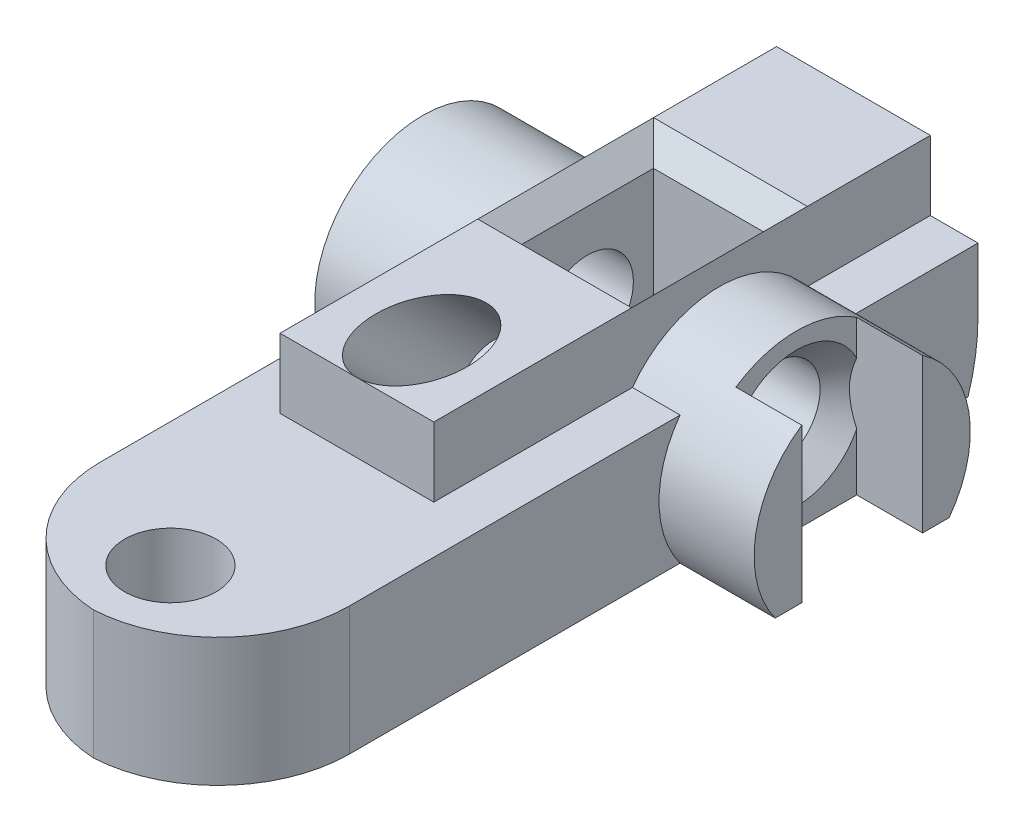
from build123d import *

# Parameters (mm, degrees)
BOSS_EXTRUDE1_DEPTH      = 20
SKETCH3_W                = 11.34
SKETCH3_H                = 5.84
BOSS_EXTRUDE2_DEPTH      = 25
FILLET1_R                = 6
SKETCH4_W                = 7
SKETCH4_H                = 8
BOSS_EXTRUDE3_DEPTH      = 9
BOSS_EXTRUDE4_DEPTH      = 13
BOSS_EXTRUDE4_DEPTH_BACK = 9.6
SKETCH10_W               = 7
SKETCH10_H               = 3.16
SKETCH5_W                = 5
SKETCH5_H                = 6
CUT_EXTRUDE1_DEPTH       = 9
SKETCH6_R                = 2.0825
CUT_EXTRUDE2_DEPTH       = 5.84
CUT_EXTRUDE3_REACH       = 34.581
SKETCH8_R                = 2.0825
CUT_EXTRUDE4_REACH       = 35.25
CUT_EXTRUDE4_END_RADIUS  = 4.92
CUT_EXTRUDE5_DEPTH       = 11.34
SKETCH13_R               = 2.0825
CUT_EXTRUDE7_DEPTH       = 8
SKETCH14_W               = 5
SKETCH14_H               = 6
BOSS_EXTRUDE5_DEPTH      = 1


with BuildPart() as part:
    # Sketch2 → Boss-Extrude1 (new body)
    with BuildSketch(Plane(origin=(0, 0, 0), x_dir=(0, 0, -1), z_dir=(1, 0, 0))):
        with BuildLine():
            Line((3.959797975, -2.92), (-3.959797975, -2.92))
            ThreePointArc((-3.959797975, -2.92), (-4.92, 0), (-3.959797975, 2.92))
            ThreePointArc((-3.959797975, 2.92), (0, 4.92), (3.959797975, 2.92))
            ThreePointArc((3.959797975, 2.92), (4.92, 0), (3.959797975, -2.92))
        make_face()
    extrude(amount=BOSS_EXTRUDE1_DEPTH)

    # Sketch3 → Boss-Extrude2 (add)
    with BuildSketch(Plane.XY):
        with Locations((10, 0)):
            Rectangle(SKETCH3_W, SKETCH3_H)
    extrude(amount=BOSS_EXTRUDE2_DEPTH)

    # Fillet1
    # the kernel refuses this fillet: 6 mm, written as the material it takes off along each edge
    with BuildSketch(Plane(origin=(15.67, -17.92, 25), x_dir=(0, 0, -1), z_dir=(0, 1, 0)), Plane(origin=(4.33, 17.92, 25), x_dir=(0, 0, -1), z_dir=(0, -1, 0))) as fillet1_piece_1:
        with BuildLine():
            CenterArc((FILLET1_R, FILLET1_R), FILLET1_R, 180, 90)
            Line((0, FILLET1_R), (0, 0))
            Line((0, 0), (FILLET1_R, 0))
        make_face()
    extrude(amount=35.84, mode=Mode.SUBTRACT)

    # Sketch4 → Boss-Extrude3 (add)
    with BuildSketch(Plane.XZ.offset(2.92)):
        with Locations((10, 0.040202025)):
            Rectangle(SKETCH4_W, SKETCH4_H)
    extrude(amount=-BOSS_EXTRUDE3_DEPTH)

    # Sketch10 → Boss-Extrude4 (add, two sides: drawn at the far end of the back side and taken through both)
    with BuildSketch(Plane.XY.offset(-BOSS_EXTRUDE4_DEPTH_BACK)):
        with Locations((10, 4.5)):
            Rectangle(SKETCH10_W, SKETCH10_H)
        Polygon((6.5, 2.92), (13.5, 2.92), (15.67, 2.92), (15.67, -2.92), (10, -2.92), (4.33, -2.92), (4.33, 2.92), align=None)
    extrude(amount=BOSS_EXTRUDE4_DEPTH + BOSS_EXTRUDE4_DEPTH_BACK)

    # Sketch5 → Cut-Extrude1 (cut)
    with BuildSketch(Plane(origin=(0, 6.08, 0), x_dir=(1, 0, 0), z_dir=(0, 1, 0))):
        with Locations((10, 0)):
            Rectangle(SKETCH5_W, SKETCH5_H)
    extrude(amount=-CUT_EXTRUDE1_DEPTH, mode=Mode.SUBTRACT)

    # Sketch6 → Cut-Extrude2 (cut)
    with BuildSketch(Plane(origin=(0, 2.92, 0), x_dir=(1, 0, 0), z_dir=(0, 1, 0))):
        with Locations(Location((10, -21.490918127, 0), (0, 0, 180))):
            Circle(SKETCH6_R)
    extrude(amount=-CUT_EXTRUDE2_DEPTH, mode=Mode.SUBTRACT)

    # Cut-Extrude3: up to this face of the body (flat: up to its plane)
    cut_extrude3_end = Plane(part.part.faces().sort_by_distance((0, 0.637144392, 0))[0])
    # Sketch8 → Cut-Extrude3 (cut, up to the picked face)
    with BuildSketch(Plane(origin=(20, 0, 0), x_dir=(0, 0, -1), z_dir=(1, 0, 0)), mode=Mode.PRIVATE) as cut_extrude3_sk1:
        with Locations((0, 1.08)):
            Circle(SKETCH8_R)
    cut_extrude3_tool1 = split(extrude(cut_extrude3_sk1.sketch, amount=-CUT_EXTRUDE3_REACH, mode=Mode.PRIVATE), bisect_by=cut_extrude3_end, keep=Keep.BOTH, mode=Mode.PRIVATE)
    add(cut_extrude3_tool1.solids().sort_by(Axis((20, 1.08, 0), (-1, 0, 0)))[0], mode=Mode.SUBTRACT)

    # Cut-Extrude4: up to this cylinder (the profile starts inside it)
    cut_extrude4_end = Plane(origin=(18.5, 0, 0), z_dir=(-1, 0, 0)) * Cylinder(CUT_EXTRUDE4_END_RADIUS, 81.34, mode=Mode.PRIVATE)
    # Sketch9 → Cut-Extrude4 (cut, up to the surface)
    with BuildSketch(Plane(origin=(0, -2.92, 0), x_dir=(1, 0, 0), z_dir=(0, 1, 0)), mode=Mode.PRIVATE) as cut_extrude4_sk1:
        Polygon((17, -2.75), (20, -2.75), (20, -2.0825), (20, 2.0825), (20, 2.75), (17, 2.75), align=None)
    cut_extrude4_tool1 = extrude(cut_extrude4_sk1.sketch, amount=CUT_EXTRUDE4_REACH, mode=Mode.PRIVATE) & cut_extrude4_end
    add(cut_extrude4_tool1.solids().sort_by_distance((18.5, -2.92, 0))[0], mode=Mode.SUBTRACT)

    # Chamfer1
    # the kernel refuses this chamfer: 1 mm, written as the material it takes off along each edge
    with BuildSketch(Plane(origin=(12.5, 6.08, 3), x_dir=(-0.027495876610585623, -0.9996219169112968, 0), z_dir=(0, 0, -1)), Plane(origin=(7.5, 6.08, -3), x_dir=(0.027495876610586487, -0.9996219169112968, 0), z_dir=(0, 0, 1))) as chamfer1_piece_1:
        with BuildLine():
            Line((1.028673195, 0), (-0.056547155, -1.027117794))
            Line((-0.056547155, -1.027117794), (-0.076539593, -1.026567876))
            ThreePointArc((-0.076539593, -1.026567876), (-0.034129227, -0.51339783), (-0.019992438, 0.000549918))
            Line((-0.019992438, 0.000549918), (0.000549918, 0.019992438))
            ThreePointArc((0.000549918, 0.019992438), (0.514497665, 0.00585565), (1.029223113, 0.019992438))
            Line((1.029223113, 0.019992438), (1.028673195, 0))
        make_face()
    extrude(amount=6, mode=Mode.SUBTRACT)
    with BuildSketch(Plane(origin=(12.5, 6.08, -3), x_dir=(0, -0.9996219169112968, 0.027495876610586487), z_dir=(-1, 0, 0)), Plane(origin=(7.5, 6.08, 3), x_dir=(0, -0.9996219169112968, -0.027495876610586487), z_dir=(1, 0, 0))) as chamfer1_piece_2:
        with BuildLine():
            Line((1.028673195, 0), (-0.056547155, -1.027117794))
            Line((-0.056547155, -1.027117794), (-0.076539593, -1.026567876))
            ThreePointArc((-0.076539593, -1.026567876), (-0.034129227, -0.51339783), (-0.019992438, 0.000549918))
            Line((-0.019992438, 0.000549918), (0.000549918, 0.019992438))
            ThreePointArc((0.000549918, 0.019992438), (0.514497665, 0.00585565), (1.029223113, 0.019992438))
            Line((1.029223113, 0.019992438), (1.028673195, 0))
        make_face()
    extrude(amount=5, mode=Mode.SUBTRACT)
    with BuildSketch(Plane(origin=(0, 1.08, 0), x_dir=(0, 0, -1), z_dir=(0, -1, 0))) as chamfer1_piece_3:
        with BuildLine():
            Line((3.110784271, -0.028284271), (2.054215729, 1.028284271))
            Line((2.054215729, 1.028284271), (2.034215729, 1.028284271))
            ThreePointArc((2.034215729, 1.028284271), (2.0625, 0.514142136), (2.0625, 0))
            Line((2.0625, 0), (2.0825, -0.02))
            ThreePointArc((2.0825, -0.02), (2.596642136, -0.02), (3.110784271, -0.048284271))
            Line((3.110784271, -0.048284271), (3.110784271, -0.028284271))
        make_face()
    revolve(axis=Axis((0, 1.08, 0), (1, 0, 0)), mode=Mode.SUBTRACT)
    with BuildSketch(Plane(origin=(17, 1.08, 0), x_dir=(0, 0, -1), z_dir=(0, -1, 0))) as chamfer1_piece_4_section:
        with BuildLine():
            Line((3.110784271, 0.028284271), (2.054215729, -1.028284271))
            Line((2.054215729, -1.028284271), (2.034215729, -1.028284271))
            ThreePointArc((2.034215729, -1.028284271), (2.0625, -0.514142136), (2.0625, 0))
            Line((2.0625, 0), (2.0825, 0.02))
            ThreePointArc((2.0825, 0.02), (2.596642136, 0.02), (3.110784271, 0.048284271))
            Line((3.110784271, 0.048284271), (3.110784271, 0.028284271))
        make_face()
    chamfer1_piece_4 = revolve(axis=Axis((17, 1.08, 0), (1, 0, 0)), mode=Mode.PRIVATE)
    chamfer1_piece_4 = split(chamfer1_piece_4, bisect_by=Plane(origin=(16.514214791, 1.08, -2.75), z_dir=(0, 0, 1)), keep=Keep.TOP, mode=Mode.PRIVATE)
    chamfer1_piece_4 = split(chamfer1_piece_4, bisect_by=Plane(origin=(16.514214791, 1.08, 2.75), z_dir=(0, 0, -1)), keep=Keep.TOP, mode=Mode.PRIVATE)
    add(chamfer1_piece_4, mode=Mode.SUBTRACT)
    with BuildSketch(Plane(origin=(7.5, 6.08, 3), x_dir=(0, -0.9996219169112968, -0.027495876610586487), z_dir=(1, 0, 0))) as chamfer1_piece_5a_section:
        with BuildLine():
            Line((1.028673195, 0), (-0.056547155, -1.027117794))
            Line((-0.056547155, -1.027117794), (-0.076539593, -1.026567876))
            ThreePointArc((-0.076539593, -1.026567876), (-0.034129227, -0.51339783), (-0.019992438, 0.000549918))
            Line((-0.019992438, 0.000549918), (0.000549918, 0.019992438))
            ThreePointArc((0.000549918, 0.019992438), (0.514497665, 0.00585565), (1.029223113, 0.019992438))
            Line((1.029223113, 0.019992438), (1.028673195, 0))
        make_face()
    chamfer1_piece_5a = extrude(amount=7.571682988, mode=Mode.PRIVATE)
    chamfer1_piece_5a = split(chamfer1_piece_5a, bisect_by=Plane(origin=(12.5, 5.750206373, 3.329793627), z_dir=(1, 0, 0)), keep=Keep.TOP, mode=Mode.PRIVATE)
    with BuildSketch(Plane(origin=(12.5, 6.08, 5.571682988), x_dir=(-0.027495876610585623, -0.9996219169112968, 0), z_dir=(0, 0, -1))) as chamfer1_piece_5b_section:
        with BuildLine():
            Line((1.028673195, 0), (-0.056547155, -1.027117794))
            Line((-0.056547155, -1.027117794), (-0.076539593, -1.026567876))
            ThreePointArc((-0.076539593, -1.026567876), (-0.034129227, -0.51339783), (-0.019992438, 0.000549918))
            Line((-0.019992438, 0.000549918), (0.000549918, 0.019992438))
            ThreePointArc((0.000549918, 0.019992438), (0.514497665, 0.00585565), (1.029223113, 0.019992438))
            Line((1.029223113, 0.019992438), (1.028673195, 0))
        make_face()
    chamfer1_piece_5b = extrude(amount=8.571682988, mode=Mode.PRIVATE)
    chamfer1_piece_5b = split(chamfer1_piece_5b, bisect_by=Plane(origin=(12.829793627, 5.750206373, 3), z_dir=(0, 0, 1)), keep=Keep.TOP, mode=Mode.PRIVATE)
    chamfer1_piece_5 = chamfer1_piece_5a & chamfer1_piece_5b
    add(chamfer1_piece_5, mode=Mode.SUBTRACT)
    with BuildSketch(Plane(origin=(15.071682988, 6.08, -3), x_dir=(0, -0.9996219169112968, 0.027495876610586487), z_dir=(-1, 0, 0))) as chamfer1_piece_6a_section:
        with BuildLine():
            Line((1.028673195, 0), (-0.056547155, -1.027117794))
            Line((-0.056547155, -1.027117794), (-0.076539593, -1.026567876))
            ThreePointArc((-0.076539593, -1.026567876), (-0.034129227, -0.51339783), (-0.019992438, 0.000549918))
            Line((-0.019992438, 0.000549918), (0.000549918, 0.019992438))
            ThreePointArc((0.000549918, 0.019992438), (0.514497665, 0.00585565), (1.029223113, 0.019992438))
            Line((1.029223113, 0.019992438), (1.028673195, 0))
        make_face()
    chamfer1_piece_6a = extrude(amount=7.571682988, mode=Mode.PRIVATE)
    chamfer1_piece_6a = split(chamfer1_piece_6a, bisect_by=Plane(origin=(12.5, 5.750206373, -3.329793627), z_dir=(1, 0, 0)), keep=Keep.TOP, mode=Mode.PRIVATE)
    with BuildSketch(Plane(origin=(12.5, 6.08, 3), x_dir=(-0.027495876610585623, -0.9996219169112968, 0), z_dir=(0, 0, -1))) as chamfer1_piece_6b_section:
        with BuildLine():
            Line((1.028673195, 0), (-0.056547155, -1.027117794))
            Line((-0.056547155, -1.027117794), (-0.076539593, -1.026567876))
            ThreePointArc((-0.076539593, -1.026567876), (-0.034129227, -0.51339783), (-0.019992438, 0.000549918))
            Line((-0.019992438, 0.000549918), (0.000549918, 0.019992438))
            ThreePointArc((0.000549918, 0.019992438), (0.514497665, 0.00585565), (1.029223113, 0.019992438))
            Line((1.029223113, 0.019992438), (1.028673195, 0))
        make_face()
    chamfer1_piece_6b = extrude(amount=8.571682988, mode=Mode.PRIVATE)
    chamfer1_piece_6b = split(chamfer1_piece_6b, bisect_by=Plane(origin=(12.829793627, 5.750206373, -3), z_dir=(0, 0, -1)), keep=Keep.TOP, mode=Mode.PRIVATE)
    chamfer1_piece_6 = chamfer1_piece_6a & chamfer1_piece_6b
    add(chamfer1_piece_6, mode=Mode.SUBTRACT)
    with BuildSketch(Plane(origin=(7.5, 6.08, -5.571682988), x_dir=(0.027495876610586487, -0.9996219169112968, 0), z_dir=(0, 0, 1))) as chamfer1_piece_7a_section:
        with BuildLine():
            Line((1.028673195, 0), (-0.056547155, -1.027117794))
            Line((-0.056547155, -1.027117794), (-0.076539593, -1.026567876))
            ThreePointArc((-0.076539593, -1.026567876), (-0.034129227, -0.51339783), (-0.019992438, 0.000549918))
            Line((-0.019992438, 0.000549918), (0.000549918, 0.019992438))
            ThreePointArc((0.000549918, 0.019992438), (0.514497665, 0.00585565), (1.029223113, 0.019992438))
            Line((1.029223113, 0.019992438), (1.028673195, 0))
        make_face()
    chamfer1_piece_7a = extrude(amount=8.571682988, mode=Mode.PRIVATE)
    chamfer1_piece_7a = split(chamfer1_piece_7a, bisect_by=Plane(origin=(7.170206373, 5.750206373, -3), z_dir=(0, 0, -1)), keep=Keep.TOP, mode=Mode.PRIVATE)
    with BuildSketch(Plane(origin=(12.5, 6.08, -3), x_dir=(0, -0.9996219169112968, 0.027495876610586487), z_dir=(-1, 0, 0))) as chamfer1_piece_7b_section:
        with BuildLine():
            Line((1.028673195, 0), (-0.056547155, -1.027117794))
            Line((-0.056547155, -1.027117794), (-0.076539593, -1.026567876))
            ThreePointArc((-0.076539593, -1.026567876), (-0.034129227, -0.51339783), (-0.019992438, 0.000549918))
            Line((-0.019992438, 0.000549918), (0.000549918, 0.019992438))
            ThreePointArc((0.000549918, 0.019992438), (0.514497665, 0.00585565), (1.029223113, 0.019992438))
            Line((1.029223113, 0.019992438), (1.028673195, 0))
        make_face()
    chamfer1_piece_7b = extrude(amount=7.571682988, mode=Mode.PRIVATE)
    chamfer1_piece_7b = split(chamfer1_piece_7b, bisect_by=Plane(origin=(7.5, 5.750206373, -3.329793627), z_dir=(-1, 0, 0)), keep=Keep.TOP, mode=Mode.PRIVATE)
    chamfer1_piece_7 = chamfer1_piece_7a & chamfer1_piece_7b
    add(chamfer1_piece_7, mode=Mode.SUBTRACT)
    with BuildSketch(Plane(origin=(7.5, 6.08, -3), x_dir=(0.027495876610586487, -0.9996219169112968, 0), z_dir=(0, 0, 1))) as chamfer1_piece_8a_section:
        with BuildLine():
            Line((1.028673195, 0), (-0.056547155, -1.027117794))
            Line((-0.056547155, -1.027117794), (-0.076539593, -1.026567876))
            ThreePointArc((-0.076539593, -1.026567876), (-0.034129227, -0.51339783), (-0.019992438, 0.000549918))
            Line((-0.019992438, 0.000549918), (0.000549918, 0.019992438))
            ThreePointArc((0.000549918, 0.019992438), (0.514497665, 0.00585565), (1.029223113, 0.019992438))
            Line((1.029223113, 0.019992438), (1.028673195, 0))
        make_face()
    chamfer1_piece_8a = extrude(amount=8.571682988, mode=Mode.PRIVATE)
    chamfer1_piece_8a = split(chamfer1_piece_8a, bisect_by=Plane(origin=(7.170206373, 5.750206373, 3), z_dir=(0, 0, 1)), keep=Keep.TOP, mode=Mode.PRIVATE)
    with BuildSketch(Plane(origin=(4.928317012, 6.08, 3), x_dir=(0, -0.9996219169112968, -0.027495876610586487), z_dir=(1, 0, 0))) as chamfer1_piece_8b_section:
        with BuildLine():
            Line((1.028673195, 0), (-0.056547155, -1.027117794))
            Line((-0.056547155, -1.027117794), (-0.076539593, -1.026567876))
            ThreePointArc((-0.076539593, -1.026567876), (-0.034129227, -0.51339783), (-0.019992438, 0.000549918))
            Line((-0.019992438, 0.000549918), (0.000549918, 0.019992438))
            ThreePointArc((0.000549918, 0.019992438), (0.514497665, 0.00585565), (1.029223113, 0.019992438))
            Line((1.029223113, 0.019992438), (1.028673195, 0))
        make_face()
    chamfer1_piece_8b = extrude(amount=7.571682988, mode=Mode.PRIVATE)
    chamfer1_piece_8b = split(chamfer1_piece_8b, bisect_by=Plane(origin=(7.5, 5.750206373, 3.329793627), z_dir=(-1, 0, 0)), keep=Keep.TOP, mode=Mode.PRIVATE)
    chamfer1_piece_8 = chamfer1_piece_8a & chamfer1_piece_8b
    add(chamfer1_piece_8, mode=Mode.SUBTRACT)

    # Sketch11 → Cut-Extrude5 (cut)
    with BuildSketch(Plane.ZY.offset(-4.33)):
        with BuildLine():
            Line((-9.145140786, -2.92), (-9.6, -2.92))
            Line((-9.6, -2.92), (-9.6, 0))
            ThreePointArc((-9.6, 0), (-9.485603606, -1.477607602), (-9.145140786, -2.92))
        make_face()
    extrude(amount=-CUT_EXTRUDE5_DEPTH, mode=Mode.SUBTRACT)

    # Sketch13 → Cut-Extrude7 (cut)
    with BuildSketch(Plane(origin=(0, 9.54, 9.54), x_dir=(-1, 0, 0), z_dir=(0, 0.7071067811865464, 0.7071067811865488))):
        with Locations(Location((-10, 2.810678926, 0), (0, 0, 90))):
            Circle(SKETCH13_R)
    extrude(amount=-CUT_EXTRUDE7_DEPTH, mode=Mode.SUBTRACT)

    # Sketch14 → Boss-Extrude5 (add)
    with BuildSketch(Plane.XZ.offset(2.92)):
        with Locations((10, 0)):
            Rectangle(SKETCH14_W, SKETCH14_H)
    extrude(amount=-BOSS_EXTRUDE5_DEPTH)


solid = part.part
